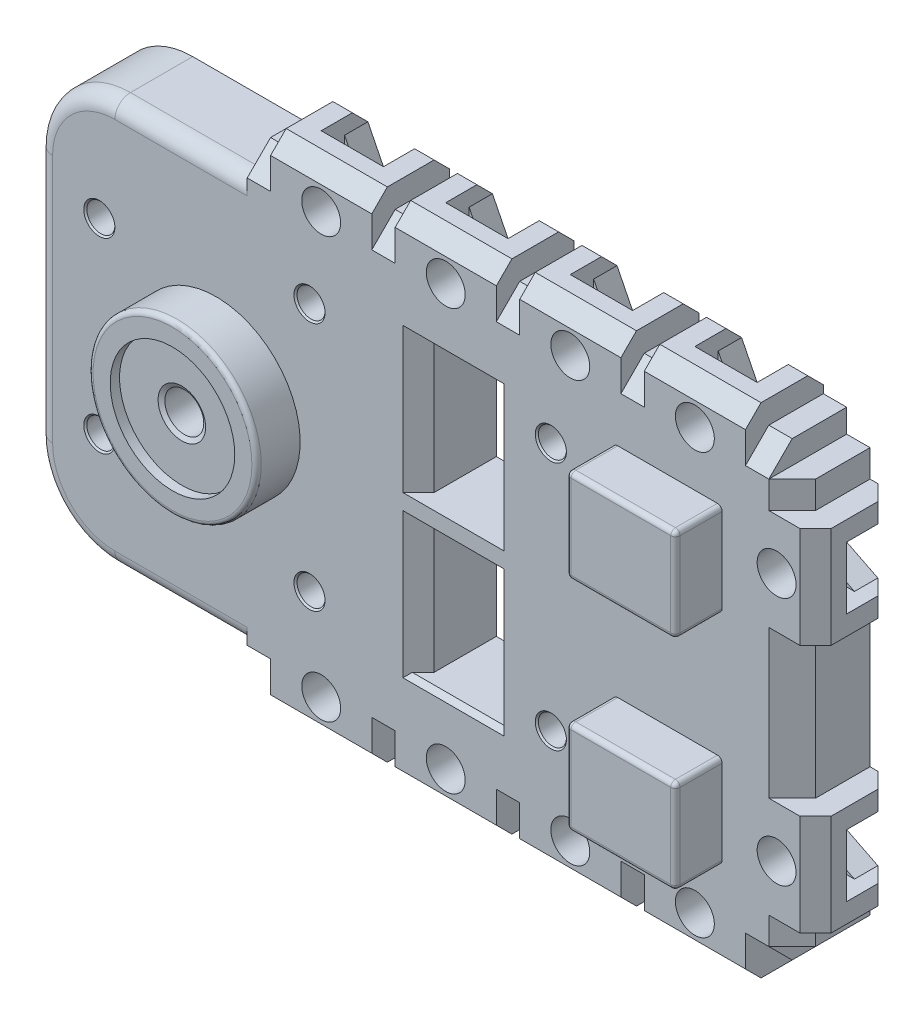
from build123d import *

# Parameters (mm, degrees)
BOSS_EXTRUDE1_DEPTH         = 2.5
SKETCH5_W                   = 7
SKETCH5_H                   = 6
BOSS_EXTRUDE3_DEPTH         = 3
SKETCH6_W                   = 3
SKETCH6_H                   = 4
CUT_EXTRUDE3_DEPTH          = 1
CUT_EXTRUDE4_DEPTH          = 1.5
CUT_EXTRUDE5_REACH          = 44.453
SKETCH10_W                  = 4
SKETCH10_H                  = 3
CUT_EXTRUDE6_DEPTH          = 1
CUT_EXTRUDE7_DEPTH          = 1.5
CUT_EXTRUDE8_REACH          = 44.453
CUT_EXTRUDE9_REACH          = 43.991
SKETCH13_R                  = 1.25
CUT_EXTRUDE10_REACH         = 43.991
SKETCH14_R                  = 1.25
LPATTERN1_COUNT             = 4
LPATTERN1_PITCH             = 8
MIRROR1_COPY_1_SKETCH_W     = 4
MIRROR1_COPY_1_SKETCH_H     = 3
MIRROR1_COPY_1_DEPTH        = 1
MIRROR1_COPY_2_SKETCH_W     = 4
MIRROR1_COPY_2_SKETCH_H     = 3
MIRROR1_COPY_2_DEPTH        = 1
MIRROR1_COPY_3_SKETCH_W     = 4
MIRROR1_COPY_3_SKETCH_H     = 3
MIRROR1_COPY_3_DEPTH        = 1
MIRROR1_COPY_4_DEPTH        = 1.5
MIRROR1_COPY_5_DEPTH        = 1.5
MIRROR1_COPY_6_DEPTH        = 1.5
MIRROR1_COPY_7_REACH        = 44.453
MIRROR1_COPY_8_REACH        = 44.453
MIRROR1_COPY_9_REACH        = 44.453
MIRROR1_COPY_10_REACH       = 43.991
MIRROR1_COPY_10_SKETCH_R    = 1.25
MIRROR1_COPY_11_REACH       = 43.991
MIRROR1_COPY_11_SKETCH_R    = 1.25
MIRROR1_COPY_12_REACH       = 43.991
MIRROR1_COPY_12_SKETCH_R    = 1.25
FILLET1_R                   = 5
SKETCH2_W                   = 4.5
SKETCH2_H                   = 9
CUT_EXTRUDE1_DEPTH          = 42.991070479
SKETCH3_R                   = 5.4
BOSS_EXTRUDE4_DEPTH         = 2.8
SKETCH17_R                  = 4
CUT_EXTRUDE13_DEPTH         = 0.6
M3_TAPPED_HOLE1_D           = 2.5
M3_TAPPED_HOLE1_CSINK_D     = 3.05
M3_TAPPED_HOLE1_CSINK_ANGLE = 120
FILLET2_R                   = 1
CHAMFER1_SIZE               = 1
CHAMFER2_SIZE               = 1.5
CHAMFER3_SIZE               = 1
CHAMFER4_SIZE               = 0.3
FILLET3_R                   = 0.3


# Read off the part's stored shape, not the designer's step: Ø1.6 (1.6) Diameter Hole1, Ø1.8 (1.8) Diameter Hole1
with BuildPart() as part:
    # Sketch1 → Boss-Extrude1 (new, symmetric)
    with BuildSketch(Plane.XY):
        Polygon((37, -13), (35.5, -13), (35.5, -14.5), (34, -14.5), (34, -16), (27.5, -16), (27.5, -14.5), (26, -14.5), (26, -16), (19.5, -16), (19.5, -14.5), (18, -14.5), (18, -16), (11.5, -16), (11.5, -14.5), (10, -14.5), (10, -16), (3.5, -16), (3.5, -14.5), (2, -14.5), (2, -13), (-11.5, -13), (-11.5, 13), (2, 13), (2, 14.5), (3.5, 14.5), (3.5, 16), (10, 16), (10, 14.5), (11.5, 14.5), (11.5, 16), (18, 16), (18, 14.5), (19.5, 14.5), (19.5, 16), (26, 16), (26, 14.5), (27.5, 14.5), (27.5, 16), (34, 16), (34, 14.5), (35.5, 14.5), (35.5, 13), (37, 13), (37, 11.25), (38.5, 11.25), (38.5, 4.75), (37, 4.75), (37, -4.75), (38.5, -4.75), (38.5, -11.25), (37, -11.25), align=None)
    extrude(amount=BOSS_EXTRUDE1_DEPTH, both=True)

    # Sketch5 → Boss-Extrude3 (add)
    with BuildSketch(Plane.XY.offset(2.5)):
        with Locations((29, 7)):
            Rectangle(SKETCH5_W, SKETCH5_H)
        with Locations((29, -7)):
            Rectangle(SKETCH5_W, SKETCH5_H)
    extrude(amount=BOSS_EXTRUDE3_DEPTH)

    # Sketch6 → Cut-Extrude3 (cut)
    with BuildSketch(Plane(origin=(38.5, 0, 0), x_dir=(0, 0, -1), z_dir=(1, 0, 0))):
        with Locations((1, 8)):
            Rectangle(SKETCH6_W, SKETCH6_H)
    cut_extrude3 = extrude(amount=-CUT_EXTRUDE3_DEPTH, mode=Mode.SUBTRACT)

    # Sketch7 → Cut-Extrude4 (cut)
    with BuildSketch(Plane(origin=(0, 0, 0.5), x_dir=(-1, 0, 0), z_dir=(0, 0, -1))):
        Polygon((-37.154700538, 6), (-34.845299462, 6), (-33.690598923, 8), (-34.845299462, 10), (-37.154700538, 10), (-38.5, 10), (-38.5, 6), align=None)
    cut_extrude4 = extrude(amount=CUT_EXTRUDE4_DEPTH, mode=Mode.SUBTRACT)

    # Sketch8 → Cut-Extrude5 (cut, up to next)
    with BuildSketch(Plane(origin=(0, 0, -2.5), x_dir=(-1, 0, 0), z_dir=(0, 0, -1)), mode=Mode.PRIVATE) as cut_extrude5_sk1:
        Polygon((-37.5, 10), (-35.5, 9), (-35.5, 7), (-37.5, 6), align=None)
    cut_extrude5_tool1 = extrude(cut_extrude5_sk1.sketch, amount=-CUT_EXTRUDE5_REACH, mode=Mode.PRIVATE) & part.part
    cut_extrude5 = cut_extrude5_tool1.solids().sort_by_distance((36.611111, 8, -2.5))[0]
    add(cut_extrude5, mode=Mode.SUBTRACT)

    # Sketch10 → Cut-Extrude6 (cut)
    with BuildSketch(Plane(origin=(0, 16, 0), x_dir=(1, 0, 0), z_dir=(0, 1, 0))):
        with Locations((30.75, 1)):
            Rectangle(SKETCH10_W, SKETCH10_H)
    cut_extrude6 = extrude(amount=-CUT_EXTRUDE6_DEPTH, mode=Mode.SUBTRACT)

    # Sketch11 → Cut-Extrude7 (cut)
    with BuildSketch(Plane(origin=(0, 0, 0.5), x_dir=(-1, 0, 0), z_dir=(0, 0, -1))):
        Polygon((-32.75, 14.654700538), (-32.75, 12.345299462), (-30.75, 11.190598923), (-28.75, 12.345299462), (-28.75, 14.654700538), (-28.75, 16), (-32.75, 16), align=None)
    cut_extrude7 = extrude(amount=CUT_EXTRUDE7_DEPTH, mode=Mode.SUBTRACT)

    # Sketch12 → Cut-Extrude8 (cut, up to next)
    with BuildSketch(Plane(origin=(0, 0, -2.5), x_dir=(-1, 0, 0), z_dir=(0, 0, -1)), mode=Mode.PRIVATE) as cut_extrude8_sk1:
        Polygon((-28.75, 15), (-29.75, 13), (-31.75, 13), (-32.75, 15), align=None)
    cut_extrude8_tool1 = extrude(cut_extrude8_sk1.sketch, amount=-CUT_EXTRUDE8_REACH, mode=Mode.PRIVATE) & part.part
    cut_extrude8 = cut_extrude8_tool1.solids().sort_by_distance((30.75, 14.111111, -2.5))[0]
    add(cut_extrude8, mode=Mode.SUBTRACT)

    # Sketch13 → Cut-Extrude9 (cut, up to next)
    with BuildSketch(Plane.XY.offset(2.5), mode=Mode.PRIVATE) as cut_extrude9_sk1:
        with Locations((36, 8)):
            Circle(SKETCH13_R)
    cut_extrude9_tool1 = extrude(cut_extrude9_sk1.sketch, amount=-CUT_EXTRUDE9_REACH, mode=Mode.PRIVATE) & part.part
    cut_extrude9 = cut_extrude9_tool1.solids().sort_by_distance((36, 8, 2.5))[0]
    add(cut_extrude9, mode=Mode.SUBTRACT)

    # Sketch14 → Cut-Extrude10 (cut, up to next)
    with BuildSketch(Plane.XY.offset(2.5), mode=Mode.PRIVATE) as cut_extrude10_sk1:
        with Locations((30.75, 13.5)):
            Circle(SKETCH14_R)
    cut_extrude10_tool1 = extrude(cut_extrude10_sk1.sketch, amount=-CUT_EXTRUDE10_REACH, mode=Mode.PRIVATE) & part.part
    cut_extrude10 = cut_extrude10_tool1.solids().sort_by_distance((30.75, 13.5, 2.5))[0]
    add(cut_extrude10, mode=Mode.SUBTRACT)

    # LPattern1: Cut-Extrude6, Cut-Extrude7, Cut-Extrude8, Cut-Extrude10 ×4
    with Locations(*[(-i * LPATTERN1_PITCH, 0, 0) for i in range(1, LPATTERN1_COUNT)]):
        add(cut_extrude6, mode=Mode.SUBTRACT)
        add(cut_extrude7, mode=Mode.SUBTRACT)
        add(cut_extrude8, mode=Mode.SUBTRACT)
        add(cut_extrude10, mode=Mode.SUBTRACT)

    # Mirror1: Cut-Extrude3, Cut-Extrude4, Cut-Extrude5, Cut-Extrude6, Cut-Extrude7, Cut-Extrude8, Cut-Extrude9, Cut-Extrude10 across plane
    add(cut_extrude3.mirror(Plane.ZX), mode=Mode.SUBTRACT)
    add(cut_extrude4.mirror(Plane.ZX), mode=Mode.SUBTRACT)
    add(cut_extrude5.mirror(Plane.ZX), mode=Mode.SUBTRACT)
    add(cut_extrude6.mirror(Plane.ZX), mode=Mode.SUBTRACT)
    add(cut_extrude7.mirror(Plane.ZX), mode=Mode.SUBTRACT)
    add(cut_extrude8.mirror(Plane.ZX), mode=Mode.SUBTRACT)
    add(cut_extrude9.mirror(Plane.ZX), mode=Mode.SUBTRACT)
    add(cut_extrude10.mirror(Plane.ZX), mode=Mode.SUBTRACT)

    # Mirror1 copy 1 sketch → Mirror1 copy 1 (cut)
    with BuildSketch(Plane(origin=(-8, -16, 0), x_dir=(1, 0, 0), z_dir=(0, -1, 0))):
        with Locations((30.75, -1)):
            Rectangle(MIRROR1_COPY_1_SKETCH_W, MIRROR1_COPY_1_SKETCH_H)
    extrude(amount=-MIRROR1_COPY_1_DEPTH, mode=Mode.SUBTRACT)

    # Mirror1 copy 2 sketch → Mirror1 copy 2 (cut)
    with BuildSketch(Plane(origin=(-16, -16, 0), x_dir=(1, 0, 0), z_dir=(0, -1, 0))):
        with Locations((30.75, -1)):
            Rectangle(MIRROR1_COPY_2_SKETCH_W, MIRROR1_COPY_2_SKETCH_H)
    extrude(amount=-MIRROR1_COPY_2_DEPTH, mode=Mode.SUBTRACT)

    # Mirror1 copy 3 sketch → Mirror1 copy 3 (cut)
    with BuildSketch(Plane(origin=(-24, -16, 0), x_dir=(1, 0, 0), z_dir=(0, -1, 0))):
        with Locations((30.75, -1)):
            Rectangle(MIRROR1_COPY_3_SKETCH_W, MIRROR1_COPY_3_SKETCH_H)
    extrude(amount=-MIRROR1_COPY_3_DEPTH, mode=Mode.SUBTRACT)

    # Mirror1 copy 4 sketch → Mirror1 copy 4 (cut)
    with BuildSketch(Plane(origin=(-8, 0, 0.5), x_dir=(-1, 0, 0), z_dir=(0, 0, -1))):
        Polygon((-32.75, -14.654700538), (-32.75, -12.345299462), (-30.75, -11.190598923), (-28.75, -12.345299462), (-28.75, -14.654700538), (-28.75, -16), (-32.75, -16), align=None)
    extrude(amount=MIRROR1_COPY_4_DEPTH, mode=Mode.SUBTRACT)

    # Mirror1 copy 5 sketch → Mirror1 copy 5 (cut)
    with BuildSketch(Plane(origin=(-16, 0, 0.5), x_dir=(-1, 0, 0), z_dir=(0, 0, -1))):
        Polygon((-32.75, -14.654700538), (-32.75, -12.345299462), (-30.75, -11.190598923), (-28.75, -12.345299462), (-28.75, -14.654700538), (-28.75, -16), (-32.75, -16), align=None)
    extrude(amount=MIRROR1_COPY_5_DEPTH, mode=Mode.SUBTRACT)

    # Mirror1 copy 6 sketch → Mirror1 copy 6 (cut)
    with BuildSketch(Plane(origin=(-24, 0, 0.5), x_dir=(-1, 0, 0), z_dir=(0, 0, -1))):
        Polygon((-32.75, -14.654700538), (-32.75, -12.345299462), (-30.75, -11.190598923), (-28.75, -12.345299462), (-28.75, -14.654700538), (-28.75, -16), (-32.75, -16), align=None)
    extrude(amount=MIRROR1_COPY_6_DEPTH, mode=Mode.SUBTRACT)

    # Mirror1 copy 7 sketch → Mirror1 copy 7 (cut, up to next)
    with BuildSketch(Plane(origin=(-8, 0, -2.5), x_dir=(-1, 0, 0), z_dir=(0, 0, -1)), mode=Mode.PRIVATE) as mirror1_copy_7_sk1:
        Polygon((-28.75, -15), (-29.75, -13), (-31.75, -13), (-32.75, -15), align=None)
    mirror1_copy_7_tool1 = extrude(mirror1_copy_7_sk1.sketch, amount=-MIRROR1_COPY_7_REACH, mode=Mode.PRIVATE) & part.part
    add(mirror1_copy_7_tool1.solids().sort_by_distance((22.75, -14.111111, -2.5))[0], mode=Mode.SUBTRACT)

    # Mirror1 copy 8 sketch → Mirror1 copy 8 (cut, up to next)
    with BuildSketch(Plane(origin=(-16, 0, -2.5), x_dir=(-1, 0, 0), z_dir=(0, 0, -1)), mode=Mode.PRIVATE) as mirror1_copy_8_sk1:
        Polygon((-28.75, -15), (-29.75, -13), (-31.75, -13), (-32.75, -15), align=None)
    mirror1_copy_8_tool1 = extrude(mirror1_copy_8_sk1.sketch, amount=-MIRROR1_COPY_8_REACH, mode=Mode.PRIVATE) & part.part
    add(mirror1_copy_8_tool1.solids().sort_by_distance((14.75, -14.111111, -2.5))[0], mode=Mode.SUBTRACT)

    # Mirror1 copy 9 sketch → Mirror1 copy 9 (cut, up to next)
    with BuildSketch(Plane(origin=(-24, 0, -2.5), x_dir=(-1, 0, 0), z_dir=(0, 0, -1)), mode=Mode.PRIVATE) as mirror1_copy_9_sk1:
        Polygon((-28.75, -15), (-29.75, -13), (-31.75, -13), (-32.75, -15), align=None)
    mirror1_copy_9_tool1 = extrude(mirror1_copy_9_sk1.sketch, amount=-MIRROR1_COPY_9_REACH, mode=Mode.PRIVATE) & part.part
    add(mirror1_copy_9_tool1.solids().sort_by_distance((6.75, -14.111111, -2.5))[0], mode=Mode.SUBTRACT)

    # Mirror1 copy 10 sketch → Mirror1 copy 10 (cut, up to next)
    with BuildSketch(Plane(origin=(-8, 0, 2.5), x_dir=(1, 0, 0), z_dir=(0, 0, 1)), mode=Mode.PRIVATE) as mirror1_copy_10_sk1:
        with Locations((30.75, -13.5)):
            Circle(MIRROR1_COPY_10_SKETCH_R)
    mirror1_copy_10_tool1 = extrude(mirror1_copy_10_sk1.sketch, amount=-MIRROR1_COPY_10_REACH, mode=Mode.PRIVATE) & part.part
    add(mirror1_copy_10_tool1.solids().sort_by_distance((22.75, -13.5, 2.5))[0], mode=Mode.SUBTRACT)

    # Mirror1 copy 11 sketch → Mirror1 copy 11 (cut, up to next)
    with BuildSketch(Plane(origin=(-16, 0, 2.5), x_dir=(1, 0, 0), z_dir=(0, 0, 1)), mode=Mode.PRIVATE) as mirror1_copy_11_sk1:
        with Locations((30.75, -13.5)):
            Circle(MIRROR1_COPY_11_SKETCH_R)
    mirror1_copy_11_tool1 = extrude(mirror1_copy_11_sk1.sketch, amount=-MIRROR1_COPY_11_REACH, mode=Mode.PRIVATE) & part.part
    add(mirror1_copy_11_tool1.solids().sort_by_distance((14.75, -13.5, 2.5))[0], mode=Mode.SUBTRACT)

    # Mirror1 copy 12 sketch → Mirror1 copy 12 (cut, up to next)
    with BuildSketch(Plane(origin=(-24, 0, 2.5), x_dir=(1, 0, 0), z_dir=(0, 0, 1)), mode=Mode.PRIVATE) as mirror1_copy_12_sk1:
        with Locations((30.75, -13.5)):
            Circle(MIRROR1_COPY_12_SKETCH_R)
    mirror1_copy_12_tool1 = extrude(mirror1_copy_12_sk1.sketch, amount=-MIRROR1_COPY_12_REACH, mode=Mode.PRIVATE) & part.part
    add(mirror1_copy_12_tool1.solids().sort_by_distance((6.75, -13.5, 2.5))[0], mode=Mode.SUBTRACT)

    # Fillet1
    fillet1_edges = [part.edges().sort_by_distance(p)[0] for p in [
        (-11.5, -13, 0),
        (-11.5, 13, 0),
    ]]
    fillet(fillet1_edges, radius=FILLET1_R)

    # Sketch2 → Cut-Extrude1 (cut, through all)
    with BuildSketch(Plane.XY.offset(2.5)):
        with Locations((15.25, 5)):
            Rectangle(SKETCH2_W, SKETCH2_H)
        with Locations((15.25, -5)):
            Rectangle(SKETCH2_W, SKETCH2_H)
    extrude(amount=-CUT_EXTRUDE1_DEPTH, mode=Mode.SUBTRACT)

    # Sketch3 → Boss-Extrude4 (add)
    with BuildSketch(Plane.XY.offset(2.5)):
        with Locations(Location((0, 0, 0), (0, 0, 180))):
            Circle(SKETCH3_R)
    extrude(amount=BOSS_EXTRUDE4_DEPTH)

    # Sketch17 → Cut-Extrude13 (cut)
    with BuildSketch(Plane.XY.offset(5.3)):
        Circle(SKETCH17_R)
    extrude(amount=-CUT_EXTRUDE13_DEPTH, mode=Mode.SUBTRACT)

    # Ø1.6 (1.6) Diameter Hole1 outline → Ø1.6 (1.6) Diameter Hole1 (revolve, cut)
    with BuildSketch(Plane(origin=(-9, -9.25, 0), x_dir=(1, 0, 0), z_dir=(0, -1, 0))):
        Polygon((0.8, 2), (0, 2.480688495), (0, -2.5), (0.9, -2.5), (0.8, -2.442264973), align=None)
    revolve(axis=Axis((-9, -9.25, 0), (0, 0, 1)), mode=Mode.SUBTRACT)

    # 1.6 _1.6_ Diameter Hole1 2 outline → 1.6 _1.6_ Diameter Hole1 2 (revolve, cut)
    with BuildSketch(Plane(origin=(-9, 9.25, 0), x_dir=(1, 0, 0), z_dir=(0, -1, 0))):
        Polygon((0.8, 2), (0, 2.480688495), (0, -2.5), (0.9, -2.5), (0.8, -2.442264973), align=None)
    revolve(axis=Axis((-9, 9.25, 0), (0, 0, 1)), mode=Mode.SUBTRACT)

    # 1.6 _1.6_ Diameter Hole1 3 outline → 1.6 _1.6_ Diameter Hole1 3 (revolve, cut)
    with BuildSketch(Plane(origin=(33, -10.4, 0), x_dir=(1, 0, 0), z_dir=(0, -1, 0))):
        Polygon((0.8, 2), (0, 2.480688495), (0, -2.5), (0.9, -2.5), (0.8, -2.442264973), align=None)
    revolve(axis=Axis((33, -10.4, 0), (0, 0, 1)), mode=Mode.SUBTRACT)

    # 1.6 _1.6_ Diameter Hole1 4 outline → 1.6 _1.6_ Diameter Hole1 4 (revolve, cut)
    with BuildSketch(Plane(origin=(33, 10.4, 0), x_dir=(1, 0, 0), z_dir=(0, -1, 0))):
        Polygon((0.8, 2), (0, 2.480688495), (0, -2.5), (0.9, -2.5), (0.8, -2.442264973), align=None)
    revolve(axis=Axis((33, 10.4, 0), (0, 0, 1)), mode=Mode.SUBTRACT)

    # M3 Tapped Hole1 (through all)
    with Locations(Plane.XY.offset(4.7)):
        with Locations((0, 0)):
            CounterSinkHole(M3_TAPPED_HOLE1_D / 2, M3_TAPPED_HOLE1_CSINK_D / 2, counter_sink_angle=M3_TAPPED_HOLE1_CSINK_ANGLE)

    # Ø1.8 (1.8) Diameter Hole1 outline → Ø1.8 (1.8) Diameter Hole1 (revolve, cut)
    with BuildSketch(Plane(origin=(-7.5, -6, 0), x_dir=(1, 0, 0), z_dir=(0, -1, 0))):
        Polygon((0, -2.5), (0.9, -2.5), (0.9, 2.4), (1, 2.5), (0, 2.5), align=None)
    revolve(axis=Axis((-7.5, -6, 0), (0, 0, 1)), mode=Mode.SUBTRACT)

    # 1.8 _1.8_ Diameter Hole1 2 outline → 1.8 _1.8_ Diameter Hole1 2 (revolve, cut)
    with BuildSketch(Plane(origin=(6, -8, 0), x_dir=(1, 0, 0), z_dir=(0, -1, 0))):
        Polygon((0, -2.5), (0.9, -2.5), (0.9, 2.4), (1, 2.5), (0, 2.5), align=None)
    revolve(axis=Axis((6, -8, 0), (0, 0, 1)), mode=Mode.SUBTRACT)

    # 1.8 _1.8_ Diameter Hole1 3 outline → 1.8 _1.8_ Diameter Hole1 3 (revolve, cut)
    with BuildSketch(Plane(origin=(21.5, -8, 0), x_dir=(1, 0, 0), z_dir=(0, -1, 0))):
        Polygon((0, -2.5), (0.9, -2.5), (0.9, 2.4), (1, 2.5), (0, 2.5), align=None)
    revolve(axis=Axis((21.5, -8, 0), (0, 0, 1)), mode=Mode.SUBTRACT)

    # 1.8 _1.8_ Diameter Hole1 4 outline → 1.8 _1.8_ Diameter Hole1 4 (revolve, cut)
    with BuildSketch(Plane(origin=(-7.5, 6, 0), x_dir=(1, 0, 0), z_dir=(0, -1, 0))):
        Polygon((0, -2.5), (0.9, -2.5), (0.9, 2.4), (1, 2.5), (0, 2.5), align=None)
    revolve(axis=Axis((-7.5, 6, 0), (0, 0, 1)), mode=Mode.SUBTRACT)

    # 1.8 _1.8_ Diameter Hole1 5 outline → 1.8 _1.8_ Diameter Hole1 5 (revolve, cut)
    with BuildSketch(Plane(origin=(21.5, 8, 0), x_dir=(1, 0, 0), z_dir=(0, -1, 0))):
        Polygon((0, -2.5), (0.9, -2.5), (0.9, 2.4), (1, 2.5), (0, 2.5), align=None)
    revolve(axis=Axis((21.5, 8, 0), (0, 0, 1)), mode=Mode.SUBTRACT)

    # 1.8 _1.8_ Diameter Hole1 6 outline → 1.8 _1.8_ Diameter Hole1 6 (revolve, cut)
    with BuildSketch(Plane(origin=(6, 8, 0), x_dir=(1, 0, 0), z_dir=(0, -1, 0))):
        Polygon((0, -2.5), (0.9, -2.5), (0.9, 2.4), (1, 2.5), (0, 2.5), align=None)
    revolve(axis=Axis((6, 8, 0), (0, 0, 1)), mode=Mode.SUBTRACT)

    # Fillet2
    fillet2_edges = [part.edges().sort_by_distance(p)[0] for p in [
        (-2.25, 13, 2.5),
        (-2.25, -13, 2.5),
        (-11.5, 0, 2.5),
        (-10.035533906, 11.535533906, 2.5),
        (-10.035533906, -11.535533906, 2.5),
    ]]
    fillet(fillet2_edges, radius=FILLET2_R)

    # Chamfer1
    chamfer1_edges = [part.edges().sort_by_distance(p)[0] for p in [
        (4.125, -16, -2.5),
        (9.375, -16, -2.5),
        (12.125, -16, -2.5),
        (17.375, -16, -2.5),
        (20.125, -16, -2.5),
        (25.375, -16, -2.5),
        (28.125, -16, -2.5),
        (33.375, -16, -2.5),
        (4.125, 16, -2.5),
        (9.375, 16, -2.5),
        (12.125, 16, -2.5),
        (17.375, 16, -2.5),
        (20.125, 16, -2.5),
        (25.375, 16, -2.5),
        (28.125, 16, -2.5),
        (33.375, 16, -2.5),
        (38.5, -10.625, -2.5),
        (38.5, -5.375, -2.5),
        (38.5, 5.375, -2.5),
        (38.5, 10.625, -2.5),
        (6.75, 16, 2.5),
        (14.75, 16, 2.5),
        (22.75, 16, 2.5),
        (30.75, 16, 2.5),
        (38.5, 8, 2.5),
        (38.5, -8, 2.5),
        (30.75, -16, 2.5),
        (22.75, -16, 2.5),
        (14.75, -16, 2.5),
        (6.75, -16, 2.5),
    ]]
    chamfer(chamfer1_edges, length=CHAMFER1_SIZE)

    # Chamfer2
    chamfer2_edges = [part.edges().sort_by_distance(p)[0] for p in [
        (34.75, 14.5, 2.5),
        (26.75, 14.5, 2.5),
        (18.75, 14.5, 2.5),
        (10.75, 14.5, 2.5),
        (2.75, 14.5, 2.5),
        (2.75, -14.5, 2.5),
        (10.75, -14.5, 2.5),
        (18.75, -14.5, 2.5),
        (26.75, -14.5, 2.5),
        (34.75, -14.5, 2.5),
        (37, -12.125, 2.5),
        (37, 0, 2.5),
        (37, 12.125, 2.5),
    ]]
    chamfer(chamfer2_edges, length=CHAMFER2_SIZE)

    # Chamfer3
    chamfer3_edges = [part.edges().sort_by_distance(p)[0] for p in [
        (17.5, 5, 2.5),
        (13, 5, 2.5),
        (17.5, -5, 2.5),
        (13, -5, 2.5),
    ]]
    chamfer(chamfer3_edges, length=CHAMFER3_SIZE)

    # Chamfer4
    chamfer4_edges = [part.edges().sort_by_distance(p)[0] for p in [
        (15.25, 9.5, 2.5),
        (15.25, -9.5, 2.5),
    ]]
    chamfer(chamfer4_edges, length=CHAMFER4_SIZE)

    # Fillet3
    fillet3_edges = [part.edges().sort_by_distance(p)[0] for p in [
        (32.5, 4, 4),
        (32.5, 10, 4),
        (25.5, 10, 4),
        (25.5, 4, 4),
        (32.5, 7, 5.5),
        (29, 10, 5.5),
        (25.5, 7, 5.5),
        (29, 4, 5.5),
        (25.5, -10, 4),
        (32.5, -10, 4),
        (32.5, -4, 4),
        (25.5, -4, 4),
        (29, -10, 5.5),
        (32.5, -7, 5.5),
        (29, -4, 5.5),
        (25.5, -7, 5.5),
        (5.4, 0, 5.3),
    ]]
    fillet(fillet3_edges, radius=FILLET3_R)


solid = part.part
